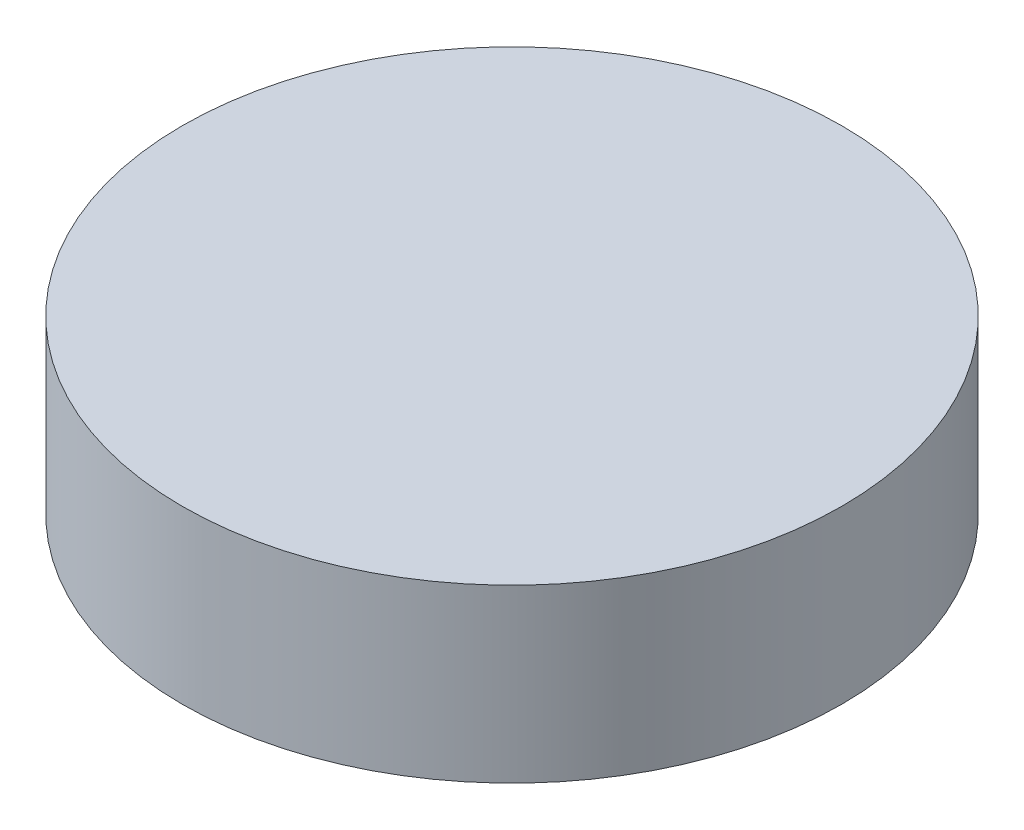
from build123d import *

# Parameters (mm, degrees)
SKETCH1_R           = 7.5
BOSS_EXTRUDE1_DEPTH = 5
SKETCH2_R           = 25
BOSS_EXTRUDE2_DEPTH = 13


with BuildPart() as part:
    # Sketch1 → Boss-Extrude1 (new body)
    with BuildSketch(Plane(origin=(0, 0, 0), x_dir=(1, 0, 0), z_dir=(0, 1, 0))):
        Circle(SKETCH1_R)
    extrude(amount=BOSS_EXTRUDE1_DEPTH)

    # Sketch2 → Boss-Extrude2 (add)
    with BuildSketch(Plane(origin=(0, 5, 0), x_dir=(1, 0, 0), z_dir=(0, 1, 0))):
        Circle(SKETCH2_R)
    extrude(amount=BOSS_EXTRUDE2_DEPTH)


solid = part.part
